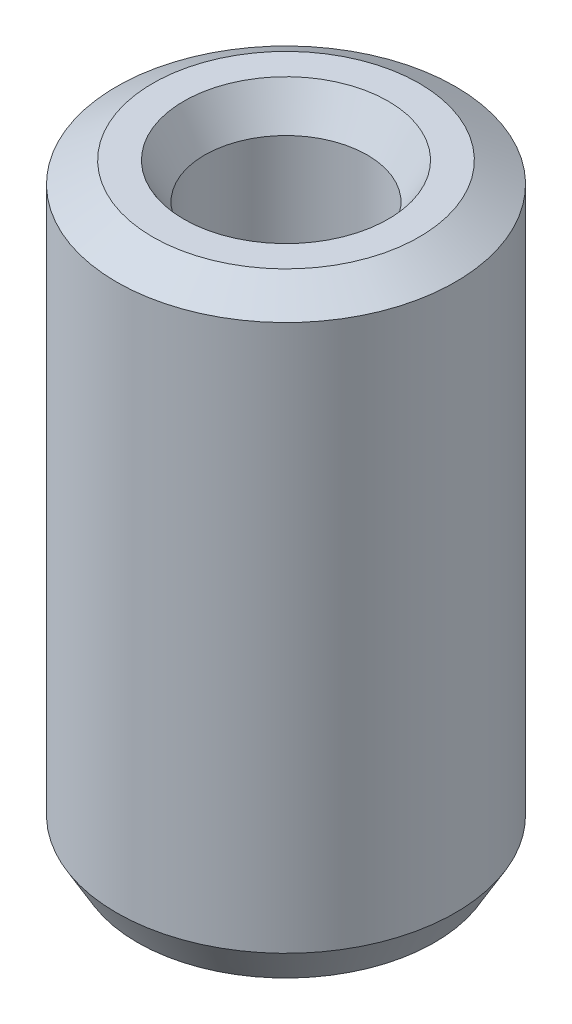
from build123d import *
from OCP.BRepFilletAPI import BRepFilletAPI_MakeChamfer

# Parameters (mm, degrees)
SKETCH1_R           = 30
BOSS_EXTRUDE1_DEPTH = 106.855356266
SKETCH2_R           = 14.406985617
CUT_EXTRUDE1_DEPTH  = 115.969853278
CHAMFER1_SIZE       = 3.69921804
CHAMFER1_SIZE2      = 6.407233594


with BuildPart() as part:
    # Sketch1 → Boss-Extrude1 (new body)
    with BuildSketch(Plane(origin=(0, 0, 0), x_dir=(1, 0, 0), z_dir=(0, 1, 0))):
        Circle(SKETCH1_R)
    extrude(amount=BOSS_EXTRUDE1_DEPTH)

    # Sketch2 → Cut-Extrude1 (cut, through all)
    with BuildSketch(Plane(origin=(0, 0, 0), x_dir=(1, 0, 0), z_dir=(0, 1, 0))):
        Circle(SKETCH2_R)
    extrude(amount=CUT_EXTRUDE1_DEPTH, mode=Mode.SUBTRACT)

    # Chamfer1: one chamfer whose edges measure the first distance from different faces: ONE call of the kernel's chamfer builder (chamfer() names one face for all edges)
    chamfer1_edges_1 = [part.edges().sort_by_distance(p)[0] for p in [
        (-14.406985617, 106.855356266, 0),
    ]]
    chamfer1_side_1 = [part.faces().sort_by_distance(p)[0] for p in [
        (-29.151471863, 106.855356266, 0),
    ]]
    chamfer1_edges_2 = [part.edges().sort_by_distance(p)[0] for p in [
        (-14.406985617, 0, 0),
    ]]
    chamfer1_side_2 = [part.faces().sort_by_distance(p)[0] for p in [
        (-14.406985617, 53.427678133, 0),
    ]]
    chamfer1_edges_3 = [part.edges().sort_by_distance(p)[0] for p in [
        (-30, 0, 0),
    ]]
    chamfer1_side_3 = [part.faces().sort_by_distance(p)[0] for p in [
        (-29.151471863, 0, 0),
    ]]
    chamfer1_edges_4 = [part.edges().sort_by_distance(p)[0] for p in [
        (-30, 106.855356266, 0),
    ]]
    chamfer1_side_4 = [part.faces().sort_by_distance(p)[0] for p in [
        (-30, 53.427678133, 0),
    ]]
    chamfer1 = BRepFilletAPI_MakeChamfer(part.part.solid().wrapped)
    for e in chamfer1_edges_1:
        chamfer1.Add(CHAMFER1_SIZE, CHAMFER1_SIZE2, e.wrapped, chamfer1_side_1[0].wrapped)  # the first distance lies on this face
    for e in chamfer1_edges_2:
        chamfer1.Add(CHAMFER1_SIZE, CHAMFER1_SIZE2, e.wrapped, chamfer1_side_2[0].wrapped)  # the first distance lies on this face
    for e in chamfer1_edges_3:
        chamfer1.Add(CHAMFER1_SIZE, CHAMFER1_SIZE2, e.wrapped, chamfer1_side_3[0].wrapped)  # the first distance lies on this face
    for e in chamfer1_edges_4:
        chamfer1.Add(CHAMFER1_SIZE, CHAMFER1_SIZE2, e.wrapped, chamfer1_side_4[0].wrapped)  # the first distance lies on this face
    add(Compound.cast(chamfer1.Shape()), mode=Mode.REPLACE)


solid = part.part
